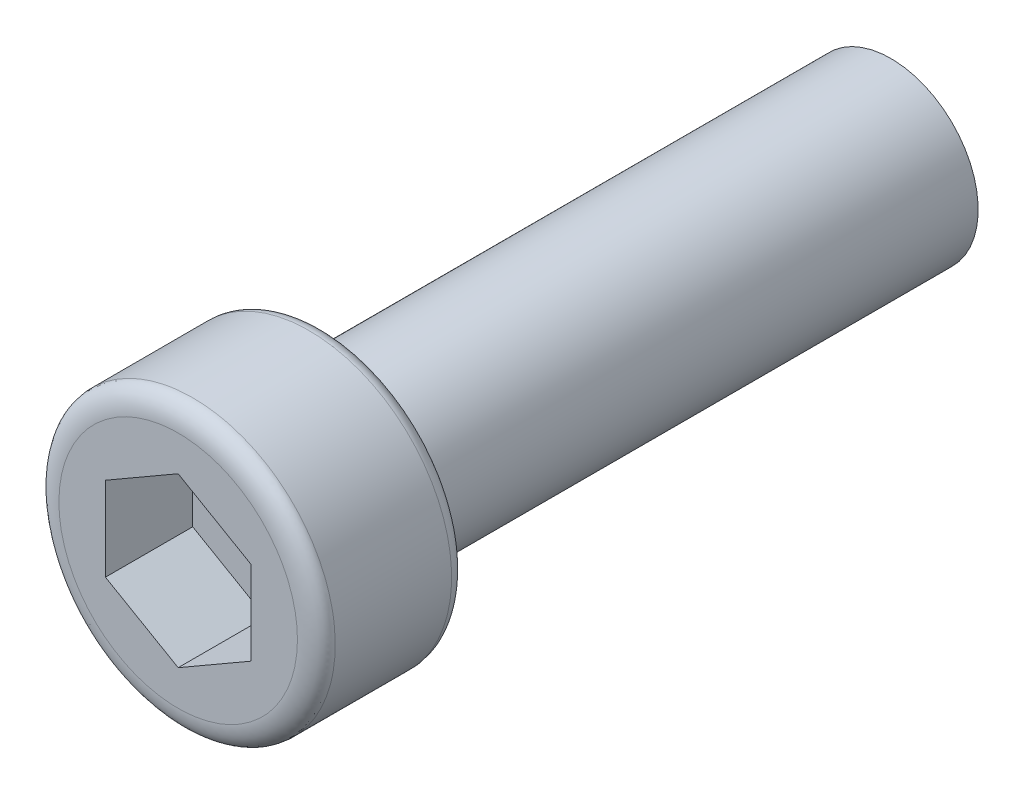
from build123d import *

# Parameters (mm, degrees)
FILLET_1_R          = 0.5
FILLET_2_SIZE       = 0.5
FILLET_2_SIZE_2     = 0.8
CHAMFER_1_SIZE      = 0.5
CHAMFER_1_SIZE2     = 0.866025404
CUT_EXTRUDE_1_DEPTH = 3


with BuildPart() as part:
    # 草图2 → 旋转1 (revolve)
    with BuildSketch(Plane(origin=(0, 0, 0), x_dir=(0, 0, -1), z_dir=(1, 0, 0)), mode=Mode.PRIVATE) as revolve_1_sk:
        Polygon((-12.5, 0), (-12.5, 4.9), (-7.5, 4.9), (-7.5, 3), (12.5, 3), (12.5, 0), align=None)
    revolve(revolve_1_sk.sketch.rotate(Axis((0, 0, -12.5), (0, 0, 1)), 90), axis=Axis((0, 0, -12.5), (0, 0, 1)))

    # 圆角1
    fillet_1_edges = [part.edges().sort_by_distance(p)[0] for p in [
        (4.9, 0, 7.5),
    ]]
    fillet(fillet_1_edges, radius=FILLET_1_R)

    # 圆角2
    # an asymmetric fillet: 0.8, 0.5 mm, written as the material it takes off along each edge
    with BuildSketch(Plane(origin=(0, 0, 12.5), x_dir=(-1, 0, 0), z_dir=(0, 1, 0))) as fillet_2_piece_1:
        with BuildLine():
            Bezier((4.9, -FILLET_2_SIZE), (4.9, 0), (4.9 - FILLET_2_SIZE_2, 0), weights=[1, 0.707106781, 1])
            Line((4.9 - FILLET_2_SIZE_2, 0), (4.9, 0))
            Line((4.9, 0), (4.9, -FILLET_2_SIZE))
        make_face()
    revolve(axis=Axis((0, 0, 12.5), (0, 0, 1)), mode=Mode.SUBTRACT)

    # 倒角1
    chamfer_1_edges = [part.edges().sort_by_distance(p)[0] for p in [
        (3, 0, -12.5),
    ]]
    chamfer_1_side = [part.faces().sort_by_distance(p)[0] for p in [
        (3, 0, -2.5),
    ]]
    chamfer(chamfer_1_edges, length=CHAMFER_1_SIZE, length2=CHAMFER_1_SIZE2, reference=chamfer_1_side[0])

    # 草图3 → 切除-拉伸1 (cut)
    with BuildSketch(Plane.XY.offset(12.5)):
        Polygon((0, 2.886751346), (-2.5, 1.443375673), (-2.5, -1.443375673), (0, -2.886751346), (2.5, -1.443375673), (2.5, 1.443375673), align=None)
    extrude(amount=-CUT_EXTRUDE_1_DEPTH, mode=Mode.SUBTRACT)


solid = part.part
